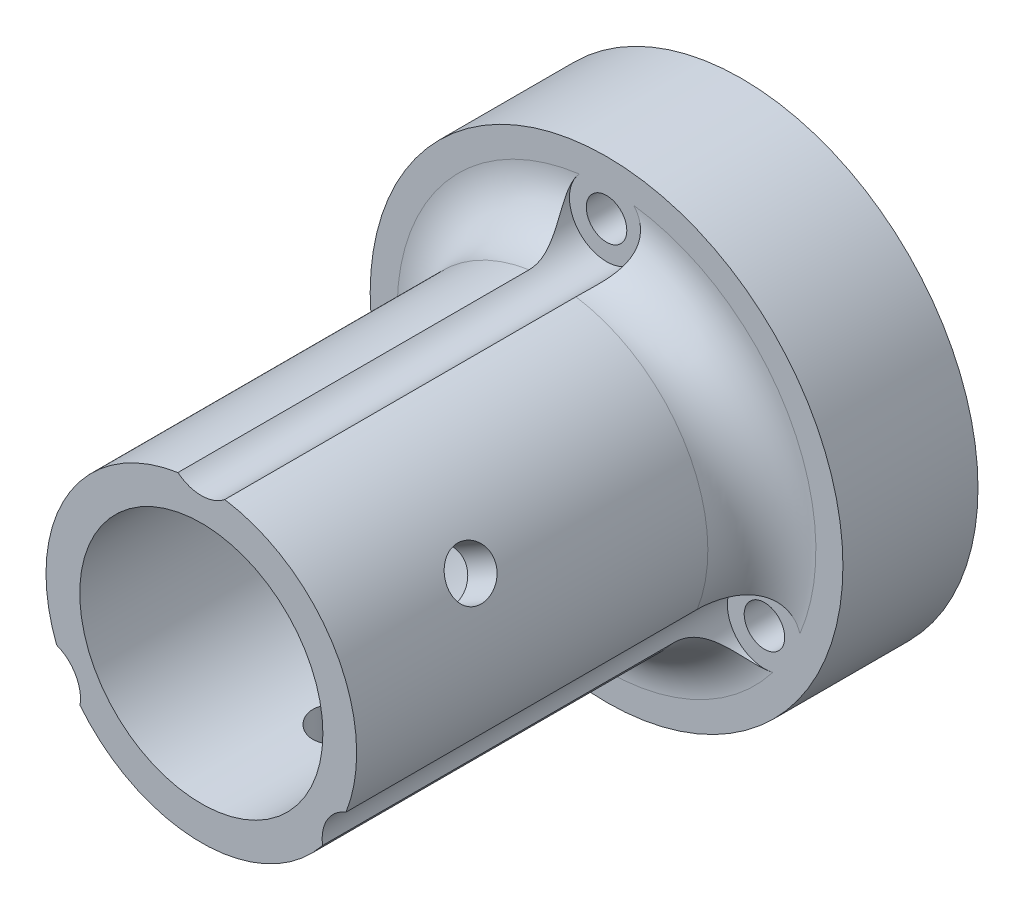
from build123d import *

# Parameters (mm, degrees)
SKETCH1_R           = 17.5
SKETCH1_R_2         = 1.5
BOSS_EXTRUDE1_DEPTH = 10
SKETCH2_R           = 9
BOSS_EXTRUDE2_DEPTH = 30
SKETCH2_2_R         = 9
CUT_EXTRUDE1_DEPTH  = 39.890872965
FILLET1_R           = 4
SKETCH4_4_W         = 1.75
SKETCH4_4_H         = 11.757944022


with BuildPart() as part:
    # Sketch1 → Boss-Extrude1 (new body)
    with BuildSketch(Plane.XY):
        Circle(SKETCH1_R)
        with Locations((0, 13.5)):
            Circle(SKETCH1_R_2, mode=Mode.SUBTRACT)
        with Locations((11.691342951, -6.75)):
            Circle(SKETCH1_R_2, mode=Mode.SUBTRACT)
        with Locations((-11.691342951, -6.75)):
            Circle(SKETCH1_R_2, mode=Mode.SUBTRACT)
    extrude(amount=BOSS_EXTRUDE1_DEPTH)

    # Sketch2 → Boss-Extrude2 (add)
    with BuildSketch(Plane.XY.offset(10)):
        with BuildLine():
            ThreePointArc((10.71198615, -4.18370084), (9.959292144, 5.75), (1.732801866, 11.368702551))
            ThreePointArc((1.732801866, 11.368702551), (0, 10.753177996), (-1.732801866, 11.368702551))
            ThreePointArc((-1.732801866, 11.368702551), (-9.959292144, 5.75), (-10.71198615, -4.18370084))
            ThreePointArc((-10.71198615, -4.18370084), (-9.312525316, -5.376588998), (-8.979184285, -7.185001711))
            ThreePointArc((-8.979184285, -7.185001711), (0, -11.5), (8.979184285, -7.185001711))
            ThreePointArc((8.979184285, -7.185001711), (9.312525316, -5.376588998), (10.71198615, -4.18370084))
        make_face()
        Circle(SKETCH2_R, mode=Mode.SUBTRACT)
    extrude(amount=BOSS_EXTRUDE2_DEPTH)

    # Sketch2<2> → Cut-Extrude1 (cut, through all)
    with BuildSketch(Plane.XY.offset(10)):
        Circle(SKETCH2_2_R)
    extrude(amount=-CUT_EXTRUDE1_DEPTH, mode=Mode.SUBTRACT)

    # Fillet1
    # the kernel refuses this fillet: 4 mm, written as the material it adds along each edge
    with BuildSketch(Plane(origin=(0, 0, 10), x_dir=(-0.9810153845306142, 0.19392992372053186, 0), z_dir=(0.19392992372053186, 0.9810153845306142, 0))) as fillet1_piece_1_section:
        with BuildLine():
            CenterArc((11.5 + FILLET1_R, FILLET1_R), FILLET1_R, 180, 90)
            Line((11.5, FILLET1_R), (11.5, 0))
            Line((11.5, 0), (11.5 + FILLET1_R, 0))
        make_face()
    fillet1_piece_1 = revolve(axis=Axis((0, 0, 10), (0, 0, 1)), revolution_arc=202.364438996, mode=Mode.PRIVATE)
    fillet1_piece_1 = fillet1_piece_1 - Plane(origin=(11.691342951, -6.75, 10.886663102), x_dir=(-0.9873805666072768, -0.15836545294442564, 0), z_dir=(0, 0, -1)) * Cylinder(2.746822004, 62, mode=Mode.PRIVATE)
    fillet1_piece_1 = fillet1_piece_1 - Plane(origin=(-11.691342951, -6.75, 10.886663102), x_dir=(0.3565417779714824, 0.9342793803573609, 0), z_dir=(0, 0, -1)) * Cylinder(2.746822004, 62, mode=Mode.PRIVATE)
    add(fillet1_piece_1)
    with BuildSketch(Plane(origin=(0, 0, 10), x_dir=(0.3225594517692616, -0.9465492063671669, 0), z_dir=(-0.9465492063671669, -0.3225594517692616, 0))) as fillet1_piece_2_section:
        with BuildLine():
            CenterArc((11.5 + FILLET1_R, FILLET1_R), FILLET1_R, 180, 90)
            Line((11.5, FILLET1_R), (11.5, 0))
            Line((11.5, 0), (11.5 + FILLET1_R, 0))
        make_face()
    fillet1_piece_2 = revolve(axis=Axis((0, 0, 10), (0, 0, 1)), revolution_arc=202.364438996, mode=Mode.PRIVATE)
    fillet1_piece_2 = fillet1_piece_2 - Plane(origin=(11.691342951, -6.75, 10.886663102), x_dir=(-0.9873805666072768, -0.15836545294442564, 0), z_dir=(0, 0, -1)) * Cylinder(2.746822004, 62, mode=Mode.PRIVATE)
    fillet1_piece_2 = fillet1_piece_2 - Plane(origin=(0, 13.5, 10.886663102), x_dir=(0.6308387886354789, -0.7759139274126491, 0), z_dir=(0, 0, -1)) * Cylinder(2.746822004, 62, mode=Mode.PRIVATE)
    add(fillet1_piece_2)
    with BuildSketch(Plane(origin=(0, 0, 10), x_dir=(0.6584559327613483, 0.7526192826465335, 0), z_dir=(0.7526192826465335, -0.6584559327613483, 0))) as fillet1_piece_3_section:
        with BuildLine():
            CenterArc((11.5 + FILLET1_R, FILLET1_R), FILLET1_R, 180, 90)
            Line((11.5, FILLET1_R), (11.5, 0))
            Line((11.5, 0), (11.5 + FILLET1_R, 0))
        make_face()
    fillet1_piece_3 = revolve(axis=Axis((0, 0, 10), (0, 0, 1)), revolution_arc=202.364438996, mode=Mode.PRIVATE)
    fillet1_piece_3 = fillet1_piece_3 - Plane(origin=(0, 13.5, 10.886663102), x_dir=(0.6308387886354789, -0.7759139274126491, 0), z_dir=(0, 0, -1)) * Cylinder(2.746822004, 63, mode=Mode.PRIVATE)
    fillet1_piece_3 = fillet1_piece_3 - Plane(origin=(-11.691342951, -6.75, 10.886663102), x_dir=(0.3565417779714824, 0.9342793803573609, 0), z_dir=(0, 0, -1)) * Cylinder(2.746822004, 63, mode=Mode.PRIVATE)
    add(fillet1_piece_3)

    # Sketch4 → Cut-Revolve1 (revolve, cut)
    with BuildSketch(Plane.XY.offset(30), mode=Mode.PRIVATE) as cut_revolve1_sk:
        Polygon((-16.858526531, 9.733274831), (-6.675848312, 3.85430282), (-7.550848312, 2.338758363), (-17.733526531, 8.217730374), align=None)
    revolve(cut_revolve1_sk.sketch.rotate(Axis((0, 0, 30), (-0.8660254037844364, 0.5000000000000039, 0)), 180), axis=Axis((0, 0, 30), (-0.8660254037844364, 0.5000000000000039, 0)), mode=Mode.SUBTRACT)

    # Sketch4<3> → Cut-Revolve2 (revolve, cut)
    with BuildSketch(Plane.XY.offset(30), mode=Mode.PRIVATE) as cut_revolve2_sk:
        Polygon((15.983526531, 11.248819288), (16.858526531, 9.733274831), (6.675848312, 3.85430282), (5.800848312, 5.369847276), align=None)
    revolve(cut_revolve2_sk.sketch.rotate(Axis((0, 0, 30), (0.8660254037844362, 0.5000000000000044, 0)), 180), axis=Axis((0, 0, 30), (0.8660254037844362, 0.5000000000000044, 0)), mode=Mode.SUBTRACT)

    # Sketch4<4> → Cut-Revolve3 (revolve, cut)
    with BuildSketch(Plane.XY.offset(30), mode=Mode.PRIVATE) as cut_revolve3_sk:
        with Locations((0.875, -13.587577651)):
            Rectangle(SKETCH4_4_W, SKETCH4_4_H)
    revolve(cut_revolve3_sk.sketch.rotate(Axis((0, 0, 30), (0, -1, 0)), 90), axis=Axis((0, 0, 30), (0, -1, 0)), mode=Mode.SUBTRACT)


solid = part.part
